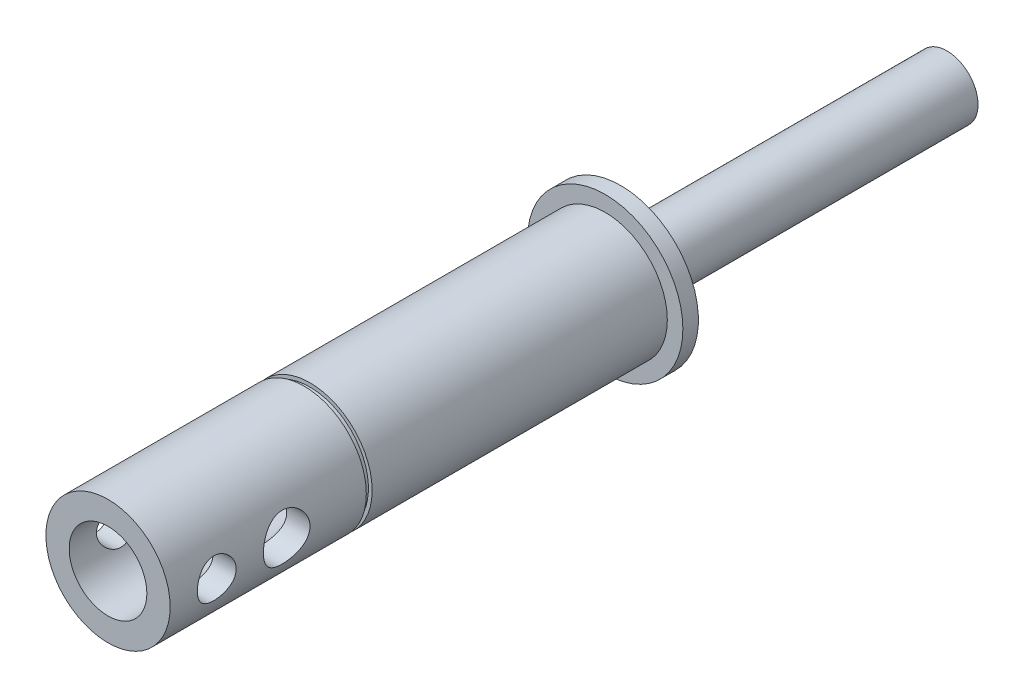
from build123d import *

# Parameters (mm, degrees)
SKETCH1_R          = 15.875
RAWSTOCK_DEPTH     = 194.6402
SKETCH10_R         = 12.7
FACINGOP_DEPTH     = 23.1902
RELIEFHOLE_D       = 12.7
RELIEFHOLE_DEPTH   = 92.075
RELIEFHOLE_TIP     = 3.815464931
WIRESHOLE_D        = 15.875
WIRESHOLE_DEPTH    = 115.2652
WIRESHOLE_TIP      = 4.769331164
SKETCH6_OUTSIDE_W  = 73.7
SKETCH6_OUTSIDE_H  = 73.7
SKETCH6_OUTSIDE_R  = 12.7
SHAFTDIAM_DEPTH    = 124.7902
SKETCH7_OUTSIDE_W  = 69.196
SKETCH7_OUTSIDE_H  = 69.196
SKETCH7_OUTSIDE_R  = 11.938
GROOVE_DEPTH       = 1.190625
SKETCH8_OUTSIDE_W  = 69.196
SKETCH8_OUTSIDE_H  = 69.196
SKETCH8_OUTSIDE_R  = 6.35
ENCODERSHAFT_DEPTH = 66.675
SKETCH12_R         = 3.96875
SKETCH12_R_2       = 4.7625
HOLES_TOP_DEPTH    = 175.538387611
SLIPRINGHOLE_D     = 4.7625
SLIPRINGHOLE_DEPTH = 25.4
SLIPRINGHOLE_TIP   = 1.430799349


with BuildPart() as part:
    # Sketch1 → RawStock (new body)
    with BuildSketch(Plane.XY):
        Circle(SKETCH1_R)
    extrude(amount=RAWSTOCK_DEPTH)

    # Sketch10 → FacingOp (cut)
    with BuildSketch(Plane.XY.offset(194.6402)):
        Circle(SKETCH10_R)
    extrude(amount=-FACINGOP_DEPTH, mode=Mode.SUBTRACT)

    # ReliefHole
    with Locations(Plane.XY.offset(194.6402)):
        with Locations((0, 0)):
            Hole(RELIEFHOLE_D / 2, depth=RELIEFHOLE_DEPTH)
            with Locations((0, 0, -(RELIEFHOLE_DEPTH + RELIEFHOLE_TIP / 2))):  # 118° drill point
                Cone(0, RELIEFHOLE_D / 2, RELIEFHOLE_TIP, mode=Mode.SUBTRACT)

    # WiresHole
    with Locations(Plane.XY.offset(194.6402)):
        with Locations((0, 0)):
            Hole(WIRESHOLE_D / 2, depth=WIRESHOLE_DEPTH)
            with Locations((0, 0, -(WIRESHOLE_DEPTH + WIRESHOLE_TIP / 2))):  # 118° drill point
                Cone(0, WIRESHOLE_D / 2, WIRESHOLE_TIP, mode=Mode.SUBTRACT)

    # Sketch6 outside → ShaftDiam (cut)
    with BuildSketch(Plane.XY.offset(194.6402)):
        Rectangle(SKETCH6_OUTSIDE_W, SKETCH6_OUTSIDE_H)
        Circle(SKETCH6_OUTSIDE_R, mode=Mode.SUBTRACT)
    extrude(amount=-SHAFTDIAM_DEPTH, mode=Mode.SUBTRACT)

    # Sketch7 outside → Groove (cut)
    with BuildSketch(Plane.XY.offset(130.175)):
        Rectangle(SKETCH7_OUTSIDE_W, SKETCH7_OUTSIDE_H)
        Circle(SKETCH7_OUTSIDE_R, mode=Mode.SUBTRACT)
    extrude(amount=GROOVE_DEPTH, mode=Mode.SUBTRACT)

    # Sketch8 outside → EncoderShaft (cut)
    with BuildSketch(Plane(origin=(0, 0, 0), x_dir=(-1, 0, 0), z_dir=(0, 0, -1))):
        Rectangle(SKETCH8_OUTSIDE_W, SKETCH8_OUTSIDE_H)
        Circle(SKETCH8_OUTSIDE_R, mode=Mode.SUBTRACT)
    extrude(amount=-ENCODERSHAFT_DEPTH, mode=Mode.SUBTRACT)

    # Sketch12 → Holes_Top (cut, through all)
    with BuildSketch(Plane(origin=(-12.7, 0, 0), x_dir=(0, 1, 0), z_dir=(-1, 0, 0))):
        with Locations((0, -161.925)):
            Circle(SKETCH12_R)
        with Locations((0, -147.6375)):
            Circle(SKETCH12_R_2)
    extrude(amount=-HOLES_TOP_DEPTH, mode=Mode.SUBTRACT)

    # SlipRingHole
    with Locations(Plane(origin=(0, 0, 66.675), x_dir=(-1, 0, 0), z_dir=(0, 0, -1))):
        with Locations((0, -8.73125)):
            Hole(SLIPRINGHOLE_D / 2, depth=SLIPRINGHOLE_DEPTH)
            with Locations((0, 0, -(SLIPRINGHOLE_DEPTH + SLIPRINGHOLE_TIP / 2))):  # 118° drill point
                Cone(0, SLIPRINGHOLE_D / 2, SLIPRINGHOLE_TIP, mode=Mode.SUBTRACT)


solid = part.part
